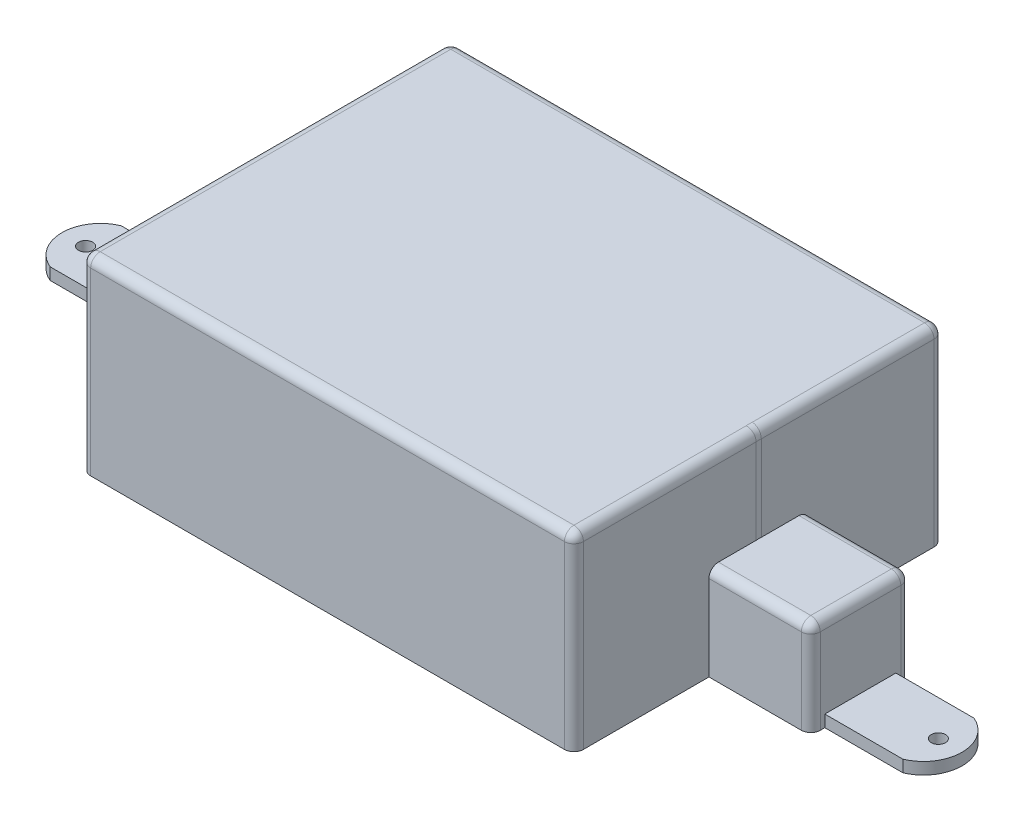
from build123d import *

# Parameters (mm, degrees)
SKETCH1_R           = 1.5
SKETCH1_W           = 3
SKETCH1_H           = 15
BOSS_EXTRUDE1_DEPTH = 40
BOSS_EXTRUDE4_DEPTH = 20
SKETCH3_R           = 1.5
CUT_EXTRUDE1_DEPTH  = 37
SKETCH4_R           = 1.5
BOSS_EXTRUDE5_DEPTH = 2.5
BOSS_EXTRUDE6_DEPTH = 20
SKETCH7_W           = 0.047941902
SKETCH7_H           = 17.5
BOSS_EXTRUDE7_DEPTH = 0.02364
SKETCH9_W           = 17
SKETCH9_H           = 15.5
CUT_EXTRUDE2_DEPTH  = 22.5
CUT_EXTRUDE3_DEPTH  = 13.5
SKETCH13_W          = 17
SKETCH13_H          = 2.5
CUT_EXTRUDE4_DEPTH  = 22.5
FILLET1_R           = 2
FILLET2_R           = 2
FILLET3_R           = 2


with BuildPart() as part:
    # Sketch1 → Boss-Extrude1 (new body)
    # profile 1 of 7: a face of its own
    with BuildSketch(Plane(origin=(0, 0, 0), x_dir=(1, 0, 0), z_dir=(0, 1, 0))):
        Polygon((-49, 7.5), (-49, 36), (49, 36), (49, 7.5), (49, -7.5), (49, -36.000000001), (-49, -36.000000001), (-49, -7.5), align=None)
        with Locations((39, 0)):
            Circle(SKETCH1_R, mode=Mode.SUBTRACT)
        with Locations((-39, 0)):
            Circle(SKETCH1_R, mode=Mode.SUBTRACT)
    # profile 2 of 7: a face of its own
    with BuildSketch(Plane(origin=(0, 0, 0), x_dir=(1, 0, 0), z_dir=(0, 1, 0))):
        Polygon((-52, 10.5), (-52, 7.5), (-49, 7.5), (-49, 36), (49, 36), (49, 7.5), (52, 7.5), (52, 10.5), (52, 39), (-52, 39), align=None)
    # profile 3 of 7: a face of its own
    with BuildSketch(Plane(origin=(0, 0, 0), x_dir=(1, 0, 0), z_dir=(0, 1, 0))):
        with BuildLine():
            Line((49, -7.5), (52, -7.5))
            Line((52, -7.5), (52, -0.546139522))
            ThreePointArc((52, -0.546139522), (51.970083663, 0), (52, 0.546139522))
            Line((52, 0.546139522), (52, 7.5))
            Line((52, 7.5), (49, 7.5))
            Line((49, 7.5), (49, -7.5))
        make_face()
    # profile 4 of 7: a face of its own
    with BuildSketch(Plane(origin=(0, 0, 0), x_dir=(1, 0, 0), z_dir=(0, 1, 0))):
        Polygon((-52, -7.5), (-52, -10.5), (-52, -39.000000001), (52, -39.000000001), (52, -10.5), (52, -7.5), (49, -7.5), (49, -36.000000001), (-49, -36.000000001), (-49, -7.5), align=None)
    # profile 5 of 7: a face of its own
    with BuildSketch(Plane(origin=(0, 0, 0), x_dir=(1, 0, 0), z_dir=(0, 1, 0))):
        with Locations((-50.5, 0)):
            Rectangle(SKETCH1_W, SKETCH1_H)
    # profile 6 of 7: a face of its own
    with BuildSketch(Plane(origin=(0, 0, 0), x_dir=(1, 0, 0), z_dir=(0, 1, 0))):
        with Locations((39, 0)):
            Circle(SKETCH1_R)
    # profile 7 of 7: a face of its own
    with BuildSketch(Plane(origin=(0, 0, 0), x_dir=(1, 0, 0), z_dir=(0, 1, 0))):
        with Locations((-39, 0)):
            Circle(SKETCH1_R)
    extrude(amount=BOSS_EXTRUDE1_DEPTH)

    # Sketch2 → Boss-Extrude4 (add)
    with BuildSketch(Plane.XZ):
        with BuildLine():
            Line((67.466015394, -7.5), (73.5, -7.5))
            Line((73.5, -7.5), (73.5, 7.5))
            Line((73.5, 7.5), (67.466015394, 7.5))
            Line((67.466015394, 7.5), (52, 7.5))
            Line((52, 7.5), (52, 0.546139522))
            ThreePointArc((52, 0.546139522), (57.243562806, 4.992515314), (61.970083663, 0))
            ThreePointArc((61.970083663, 0), (57.243562806, -4.992515313), (52, -0.546139522))
            Line((52, -0.546139522), (52, -7.5))
            Line((52, -7.5), (67.466015394, -7.5))
        make_face()
        Polygon((52, -10.5), (73.5, -10.5), (73.5, -7.5), (67.466015394, -7.5), (52, -7.5), align=None)
        with BuildLine():
            ThreePointArc((52, 0.546139522), (51.970083663, 0), (52, -0.546139522))
            ThreePointArc((52, -0.546139522), (57.243562806, -4.992515313), (61.970083663, 0))
            ThreePointArc((61.970083663, 0), (57.243562806, 4.992515314), (52, 0.546139522))
        make_face()
    extrude(amount=-BOSS_EXTRUDE4_DEPTH)

    # Sketch3 → Cut-Extrude1 (cut)
    # profile 1 of 3: a face of its own
    with BuildSketch(Plane.XZ):
        Polygon((49, 7.5), (49, -7.500000001), (49, -36.000000001), (-49, -36.000000001), (-49, -7.500000001), (-49, 7.5), (-49, 36), (49, 36), align=None)
        with Locations((39, 0)):
            Circle(SKETCH3_R, mode=Mode.SUBTRACT)
        with Locations((-39, 0)):
            Circle(SKETCH3_R, mode=Mode.SUBTRACT)
    # profile 2 of 3: a face of its own
    with BuildSketch(Plane.XZ):
        with Locations((-39, 0)):
            Circle(SKETCH3_R)
    # profile 3 of 3: a face of its own
    with BuildSketch(Plane.XZ):
        with Locations((39, 0)):
            Circle(SKETCH3_R)
    extrude(amount=-CUT_EXTRUDE1_DEPTH, mode=Mode.SUBTRACT)

    # Sketch4 → Boss-Extrude5 (add)
    # profile 1 of 2: a face of its own
    with BuildSketch(Plane.XZ):
        with BuildLine():
            ThreePointArc((-90.023637676, 7.547941902), (-93.659046318, 4.554880996), (-95.023637677, 0.047941901))
            ThreePointArc((-95.023637677, 0.047941901), (-93.659046319, -4.458997193), (-90.023637677, -7.452058099))
            Line((-90.023637677, -7.452058099), (-49.023637677, -7.452058099))
            Line((-49.023637677, -7.452058099), (-49.023637677, 7.547941902))
            Line((-49.023637677, 7.547941902), (-90.023637676, 7.547941902))
        make_face()
        with Locations(Location((-90.023637677, 0.047941901, 0), (0, 0, 270))):
            Circle(SKETCH4_R, mode=Mode.SUBTRACT)
    # profile 2 of 2: a face of its own
    with BuildSketch(Plane.XZ):
        with BuildLine():
            ThreePointArc((89.976362323, -7.452058099), (93.611770964, -4.458997193), (94.976362323, 0.047941901))
            ThreePointArc((94.976362323, 0.047941901), (93.611770964, 4.554880996), (89.976362321, 7.547941902))
            Line((89.976362321, 7.547941902), (73.476362323, 7.547941902))
            Line((73.476362323, 7.547941902), (73.476362323, -7.452058099))
            Line((73.476362323, -7.452058099), (89.976362323, -7.452058099))
        make_face()
        with Locations(Location((89.976362323, 0.047941901, 0), (0, 0, 270))):
            Circle(SKETCH4_R, mode=Mode.SUBTRACT)
    extrude(amount=-BOSS_EXTRUDE5_DEPTH)

    # Sketch6 → Boss-Extrude6 (add)
    with BuildSketch(Plane.XZ):
        Polygon((73.5, 10.5), (52, 10.5), (52, 7.5), (73.476362323, 7.5), (73.476362323, 7.547941902), (73.5, 7.547941902), align=None)
    extrude(amount=-BOSS_EXTRUDE6_DEPTH)

    # Sketch7 → Boss-Extrude7 (add)
    with BuildSketch(Plane(origin=(73.476362323, 0, 0), x_dir=(0, 0, -1), z_dir=(1, 0, 0))):
        with Locations((-7.523970951, 11.25)):
            Rectangle(SKETCH7_W, SKETCH7_H)
    extrude(amount=BOSS_EXTRUDE7_DEPTH)

    # Sketch9 → Cut-Extrude2 (cut)
    with BuildSketch(Plane.ZY.offset(-49)):
        with Locations((0, 10.25)):
            Rectangle(SKETCH9_W, SKETCH9_H)
    extrude(amount=-CUT_EXTRUDE2_DEPTH, mode=Mode.SUBTRACT)

    # Sketch11 → Cut-Extrude3 (cut)
    with BuildSketch(Plane.XZ):
        with BuildLine():
            Line((52, 0.546139523), (52, -0.546139522))
            ThreePointArc((52, -0.546139522), (57.243562806, -4.992515313), (61.970083663, 1e-09))
            ThreePointArc((61.970083663, 1e-09), (57.243562806, 4.992515315), (52, 0.546139523))
        make_face()
    extrude(amount=-CUT_EXTRUDE3_DEPTH, mode=Mode.SUBTRACT)

    # Sketch13 → Cut-Extrude4 (cut)
    with BuildSketch(Plane.ZY.offset(-49)):
        with Locations((0, 1.25)):
            Rectangle(SKETCH13_W, SKETCH13_H)
    extrude(amount=-CUT_EXTRUDE4_DEPTH, mode=Mode.SUBTRACT)

    # Fillet1
    fillet1_edges = [part.edges().sort_by_distance(p)[0] for p in [
        (73.5, 10, 10.5),
        (-52, 20, -39),
        (52, 20, -39),
        (52, 20, 39.000000001),
        (-52, 20, 39.000000001),
        (73.5, 10, -10.5),
    ]]
    fillet(fillet1_edges, radius=FILLET1_R)

    # Fillet2
    fillet2_edges = [part.edges().sort_by_distance(p)[0] for p in [
        (-52, 40, 0),
        (0, 40, -39),
        (0, 40, 39.000000001),
        (52, 40, 18.773069762),
        (51.414213562, 40, 38.414213563),
        (-51.414213562, 40, 38.414213563),
        (51.414213562, 40, -38.414213562),
        (-51.414213562, 40, -38.414213562),
        (51.970083663, 40, 0),
        (52, 40, -18.773069761),
    ]]
    fillet(fillet2_edges, radius=FILLET2_R)

    # Fillet3
    # the kernel refuses this fillet: 2 mm, written as the material it takes off along each edge
    with BuildSketch(Plane(origin=(52, 20, -10.5), x_dir=(0, -1, 0), z_dir=(1, 0, 0)), Plane(origin=(71.5, 20, 10.5), x_dir=(0, -1, 0), z_dir=(-1, 0, 0))) as fillet3_piece_1:
        with BuildLine():
            CenterArc((FILLET3_R, -FILLET3_R), FILLET3_R, 90, 90)
            Line((0, -FILLET3_R), (0, 0))
            Line((0, 0), (FILLET3_R, 0))
        make_face()
    extrude(amount=19.5, mode=Mode.SUBTRACT)
    with BuildSketch(Plane(origin=(71.5, 20, -8.5), x_dir=(1, 0, 0), z_dir=(0, 0, 1))) as fillet3_piece_2:
        with BuildLine():
            CenterArc((2 - FILLET3_R, -FILLET3_R), FILLET3_R, 0, 90)
            Line((2 - FILLET3_R, 0), (2, 0))
            Line((2, 0), (2, -FILLET3_R))
        make_face()
    revolve(axis=Axis((71.5, 20, -8.5), (0, 1, 0)), revolution_arc=90, mode=Mode.SUBTRACT)
    with BuildSketch(Plane(origin=(73.5, 20, 12.5), x_dir=(0, -1, 0), z_dir=(0, 0, -1))) as fillet3_piece_3:
        with BuildLine():
            CenterArc((FILLET3_R, FILLET3_R), FILLET3_R, 180, 90)
            Line((0, FILLET3_R), (0, 0))
            Line((0, 0), (FILLET3_R, 0))
        make_face()
    extrude(amount=21, mode=Mode.SUBTRACT)
    with BuildSketch(Plane(origin=(73.5, 20, 7.547941902), x_dir=(0, -1, 0), z_dir=(1, 0, 0)), Plane(origin=(73.5, 20, 7.5), x_dir=(0, 0, 1), z_dir=(1, 0, 0))) as fillet3_piece_4:
        with BuildLine():
            CenterArc((FILLET3_R, FILLET3_R), FILLET3_R, 180, 90)
            Line((0, FILLET3_R), (0, 0))
            Line((0, 0), (FILLET3_R, 0))
        make_face()
    extrude(amount=5.000002322, mode=Mode.SUBTRACT)
    with BuildSketch(Plane(origin=(73.5, 20, 2.547941902), x_dir=(0, -1, 0), z_dir=(0, 0, 1))) as fillet3_piece_5:
        with BuildLine():
            CenterArc((FILLET3_R, -FILLET3_R), FILLET3_R, 90, 90)
            Line((0, -FILLET3_R), (0, 0))
            Line((0, 0), (FILLET3_R, 0))
        make_face()
    extrude(amount=5.952058098, mode=Mode.SUBTRACT)
    with BuildSketch(Plane(origin=(71.5, 20, 8.5), x_dir=(0, 0, 1), z_dir=(-1, 0, 0))) as fillet3_piece_6:
        with BuildLine():
            CenterArc((2 - FILLET3_R, -FILLET3_R), FILLET3_R, 0, 90)
            Line((2 - FILLET3_R, 0), (2, 0))
            Line((2, 0), (2, -FILLET3_R))
        make_face()
    revolve(axis=Axis((71.5, 20, 8.5), (0, 1, 0)), revolution_arc=90, mode=Mode.SUBTRACT)
    with BuildSketch(Plane(origin=(73.500002323, 20, 12.547941902), x_dir=(-1, 0, 0), z_dir=(0, 0, -1))) as fillet3_piece_7:
        with BuildLine():
            CenterArc((FILLET3_R, -FILLET3_R), FILLET3_R, 90, 90)
            Line((0, -FILLET3_R), (0, 0))
            Line((0, 0), (FILLET3_R, 0))
        make_face()
    extrude(amount=10.047941902, mode=Mode.SUBTRACT)


solid = part.part
